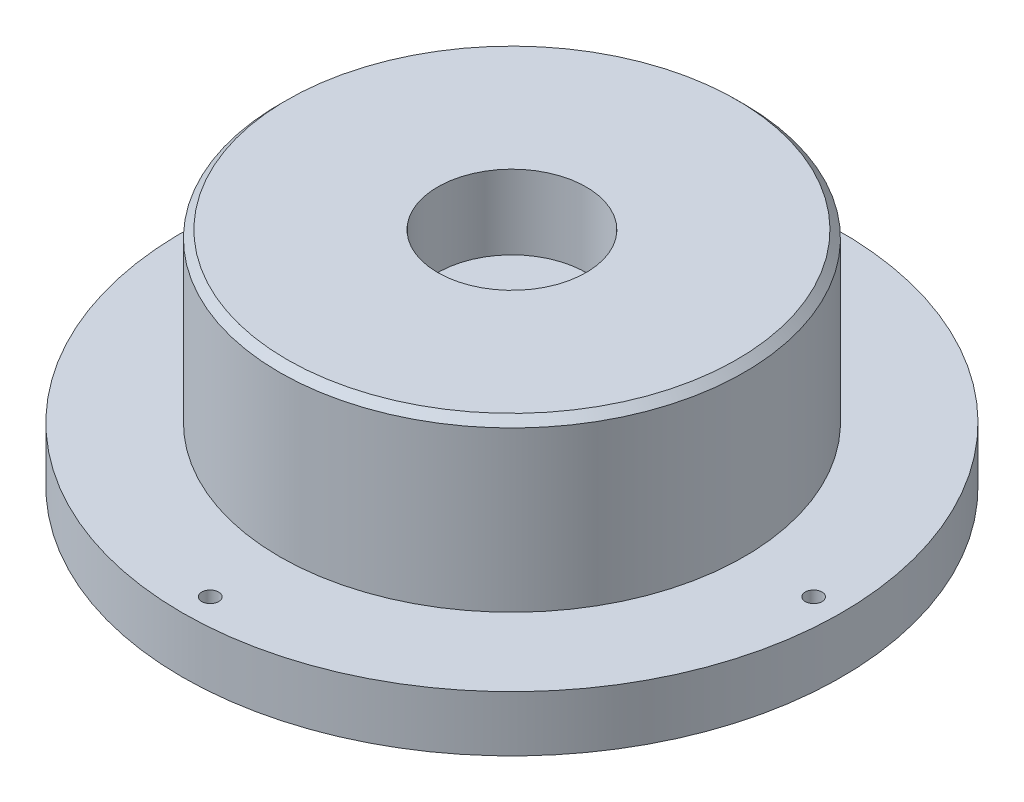
from build123d import *

# Parameters (mm, degrees)
SKETCH1_R                 = 39.749984
BOSS_EXTRUDE1_DEPTH       = 28.575
SKETCH3_R                 = 56.388
BOSS_EXTRUDE3_DEPTH       = 9.525
CHAMFER1_SIZE             = 1.27
TAP_DRILL_FOR_4_40_TAP1_D = 2.8702
SKETCH2_R                 = 12.7
CUT_EXTRUDE1_DEPTH        = 12.7


with BuildPart() as part:
    # Sketch1 → Boss-Extrude1 (new body)
    with BuildSketch(Plane(origin=(0, 0, 0), x_dir=(1, 0, 0), z_dir=(0, 1, 0))):
        Circle(SKETCH1_R)
    extrude(amount=BOSS_EXTRUDE1_DEPTH)

    # Sketch3 → Boss-Extrude3 (add)
    with BuildSketch(Plane.XZ):
        Circle(SKETCH3_R)
    extrude(amount=BOSS_EXTRUDE3_DEPTH)

    # Chamfer1
    chamfer1_edges = [part.edges().sort_by_distance(p)[0] for p in [
        (-39.749984, 28.575, 0),
    ]]
    chamfer(chamfer1_edges, length=CHAMFER1_SIZE)

    # Tap Drill for #4-40 Tap1 (through all)
    with Locations(Plane(origin=(0, 0, 0), x_dir=(1, 0, 0), z_dir=(0, 1, 0))):
        with Locations((0, 51.6255), (51.6255, 0), (0, -51.6255), (-51.6255, 0)):
            Hole(TAP_DRILL_FOR_4_40_TAP1_D / 2)

    # Sketch2 → Cut-Extrude1 (cut)
    with BuildSketch(Plane(origin=(0, 28.575, 0), x_dir=(1, 0, 0), z_dir=(0, 1, 0))):
        Circle(SKETCH2_R)
    extrude(amount=-CUT_EXTRUDE1_DEPTH, mode=Mode.SUBTRACT)


solid = part.part
